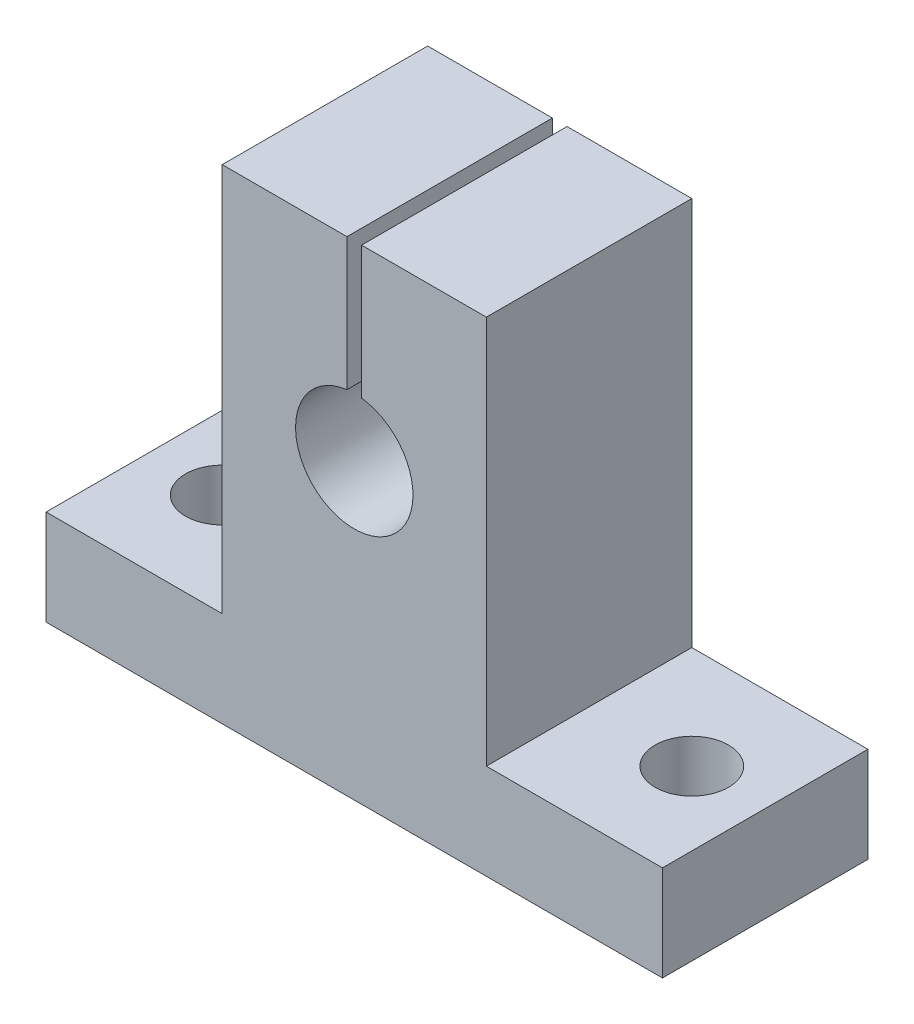
from build123d import *

# Parameters (mm, degrees)
BOSS_EXTRUDE1_DEPTH      = 7
BOSS_EXTRUDE1_DEPTH_BACK = 7
CUT_EXTRUDE1_DEPTH       = 40.013619417
SKETCH3_R                = 2.5
CUT_EXTRUDE2_DEPTH       = 35.528973341


with BuildPart() as part:
    # Sketch1 → Boss-Extrude1 (new, two sides: drawn at the far end of the back side and taken through both)
    with BuildSketch(Plane.XY.offset(-BOSS_EXTRUDE1_DEPTH_BACK)):
        Polygon((9, 3.25), (21, 3.25), (21, -3.25), (-21, -3.25), (-21, 3.25), (-9, 3.25), (-9, 29.75), (9, 29.75), align=None)
    extrude(amount=BOSS_EXTRUDE1_DEPTH + BOSS_EXTRUDE1_DEPTH_BACK)

    # Sketch2 → Cut-Extrude1 (cut, through all)
    with BuildSketch(Plane.XY.offset(7)):
        with BuildLine():
            Line((-0.5, 20.718626967), (-0.5, 29.75))
            Line((-0.5, 29.75), (0.5, 29.75))
            Line((0.5, 29.75), (0.5, 20.718626967))
            ThreePointArc((0.5, 20.718626967), (0, 12.75), (-0.5, 20.718626967))
        make_face()
    extrude(amount=-CUT_EXTRUDE1_DEPTH, mode=Mode.SUBTRACT)

    # Sketch3 → Cut-Extrude2 (cut, through all)
    with BuildSketch(Plane(origin=(0, 3.25, 0), x_dir=(1, 0, 0), z_dir=(0, 1, 0))):
        with Locations((16, 0)):
            Circle(SKETCH3_R)
        with Locations((-16, 0)):
            Circle(SKETCH3_R)
    extrude(amount=-CUT_EXTRUDE2_DEPTH, mode=Mode.SUBTRACT)


solid = part.part
